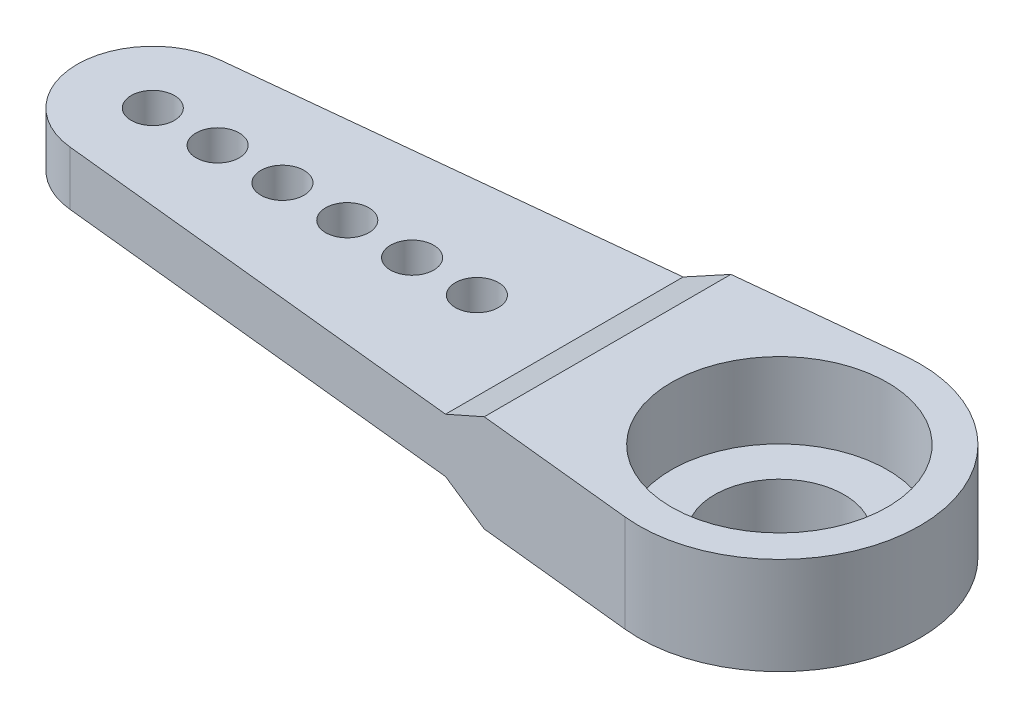
from build123d import *
from OCP.BRepFilletAPI import BRepFilletAPI_MakeChamfer

# Parameters (mm, degrees)
SKETCH_1_R       = 1
SKETCH_1_R_2     = 5
EXTRUDE_1_DEPTH  = 2.5
EXTRUDE_START    = 2.5
SKETCH_1_3_R     = 5
EXTRUDE_2_DEPTH  = 1
EXTRUDE_START_2  = -1
SKETCH_1_4_R     = 5
EXTRUDE_3_DEPTH  = 1
EXTRUDE_START_3  = -2.5
SKETCH_1_5_R     = 5
SKETCH_1_5_R_2   = 3.5
SKETCH_1_5_R_3   = 3
EXTRUDE_4_DEPTH  = 2.5
CHAMFER_1_SIZE   = 2
CHAMFER_1_SIZE_2 = 1
CHAMFER_2_SIZE   = 1


with BuildPart() as part:
    # Эскиз1 → Бобышка-Вытянуть1 (new body)
    # profile 1 of 2: a face of its own
    with BuildSketch(Plane(origin=(0, 0, 0), x_dir=(1, 0, 0), z_dir=(0, 1, 0))):
        with BuildLine():
            ThreePointArc((-29.362068966, 3.481221921), (-32.5, 0), (-29.362068966, -3.481221921))
            Line((-29.362068966, -3.481221921), (-9.951914627, -5.5))
            Line((-9.951914627, -5.5), (-9.951914627, 5.5))
            Line((-9.951914627, 5.5), (-29.362068966, 3.481221921))
        make_face()
        with Locations(Location((-29, 0, 0), (0, 0, 270))):
            Circle(SKETCH_1_R, mode=Mode.SUBTRACT)
        with Locations(Location((-26, 0, 0), (0, 0, 270))):
            Circle(SKETCH_1_R, mode=Mode.SUBTRACT)
        with Locations(Location((-23, 0, 0), (0, 0, 270))):
            Circle(SKETCH_1_R, mode=Mode.SUBTRACT)
        with Locations(Location((-20, 0, 0), (0, 0, 270))):
            Circle(SKETCH_1_R, mode=Mode.SUBTRACT)
        with Locations(Location((-17, 0, 0), (0, 0, 270))):
            Circle(SKETCH_1_R, mode=Mode.SUBTRACT)
        with Locations(Location((-14, 0, 0), (0, 0, 270))):
            Circle(SKETCH_1_R, mode=Mode.SUBTRACT)
    # profile 2 of 2: a face of its own
    with BuildSketch(Plane(origin=(0, 0, 0), x_dir=(1, 0, 0), z_dir=(0, 1, 0))):
        with BuildLine():
            Line((-9.951914627, 5.5), (-9.951914627, -5.5))
            Line((-9.951914627, -5.5), (-0.672413793, -6.465126425))
            ThreePointArc((-0.672413793, -6.465126425), (6.5, 0), (-0.672413793, 6.465126425))
            Line((-0.672413793, 6.465126425), (-9.951914627, 5.5))
        make_face()
        with Locations(Location((0, 0, 0), (0, 0, 270))):
            Circle(SKETCH_1_R_2, mode=Mode.SUBTRACT)
    extrude(amount=EXTRUDE_1_DEPTH)

    # Эскиз1<3> → Бобышка-Вытянуть2 (add)
    with BuildSketch(Plane(origin=(0, 0, 0), x_dir=(1, 0, 0), z_dir=(0, 1, 0)).offset(EXTRUDE_START)):
        with BuildLine():
            Line((-9.951914627, 5.5), (-9.951914627, -5.5))
            Line((-9.951914627, -5.5), (-0.672413793, -6.465126425))
            ThreePointArc((-0.672413793, -6.465126425), (6.5, 0), (-0.672413793, 6.465126425))
            Line((-0.672413793, 6.465126425), (-9.951914627, 5.5))
        make_face()
        with Locations(Location((0, 0, 0), (0, 0, 270))):
            Circle(SKETCH_1_3_R, mode=Mode.SUBTRACT)
    extrude(amount=EXTRUDE_2_DEPTH)

    # Эскиз1<4> → Бобышка-Вытянуть3 (add)
    with BuildSketch(Plane(origin=(0, 0, 0), x_dir=(1, 0, 0), z_dir=(0, 1, 0)).offset(EXTRUDE_START_2)):
        with BuildLine():
            Line((-9.951914627, 5.5), (-9.951914627, -5.5))
            Line((-9.951914627, -5.5), (-0.672413793, -6.465126425))
            ThreePointArc((-0.672413793, -6.465126425), (6.5, 0), (-0.672413793, 6.465126425))
            Line((-0.672413793, 6.465126425), (-9.951914627, 5.5))
        make_face()
        with Locations(Location((0, 0, 0), (0, 0, 270))):
            Circle(SKETCH_1_4_R, mode=Mode.SUBTRACT)
    extrude(amount=EXTRUDE_3_DEPTH)

    # Эскиз1<5> → Бобышка-Вытянуть4 (add)
    # profile 1 of 2: a face of its own
    with BuildSketch(Plane(origin=(0, 0, 0), x_dir=(1, 0, 0), z_dir=(0, 1, 0)).offset(EXTRUDE_START_3)):
        with Locations(Location((0, 0, 0), (0, 0, 270))):
            Circle(SKETCH_1_5_R)
        Circle(SKETCH_1_5_R_2, mode=Mode.SUBTRACT)
    # profile 2 of 2: a face of its own
    with BuildSketch(Plane(origin=(0, 0, 0), x_dir=(1, 0, 0), z_dir=(0, 1, 0)).offset(EXTRUDE_START_3)):
        Circle(SKETCH_1_5_R_2)
        with Locations(Location((0, 0, 0), (0, 0, 270))):
            Circle(SKETCH_1_5_R_3, mode=Mode.SUBTRACT)
    extrude(amount=EXTRUDE_4_DEPTH)

    # Фаска1
    chamfer_1_edges_1 = [part.edges().sort_by_distance(p)[0] for p in [
        (-9.951914627, 3.5, 0),
    ]]
    chamfer_1_side_1 = [part.faces().sort_by_distance(p)[0] for p in [
        (-9.931914627, 3.5, 0),
    ]]
    chamfer_1_edges_2 = [part.edges().sort_by_distance(p)[0] for p in [
        (-9.951914627, -1, 0),
    ]]
    chamfer_1_side_2 = [part.faces().sort_by_distance(p)[0] for p in [
        (-9.951914627, -0.98, 0),
    ]]
    chamfer_1 = BRepFilletAPI_MakeChamfer(part.part.solid().wrapped)
    for e in chamfer_1_edges_1:
        chamfer_1.Add(CHAMFER_1_SIZE - 0.0001, CHAMFER_1_SIZE_2 - 0.0001, e.wrapped, chamfer_1_side_1[0].wrapped)
    for e in chamfer_1_edges_2:
        chamfer_1.Add(CHAMFER_1_SIZE_2 - 0.0001, CHAMFER_1_SIZE - 0.0001, e.wrapped, chamfer_1_side_2[0].wrapped)
    add(Compound.cast(chamfer_1.Shape()), mode=Mode.REPLACE)  # a hair under: the kernel refuses the full size

    # Фаска2
    chamfer_2_edges = [part.edges().sort_by_distance(p)[0] for p in [
        (0, -2.5, -5),
    ]]
    chamfer(chamfer_2_edges, length=CHAMFER_2_SIZE)


solid = part.part
